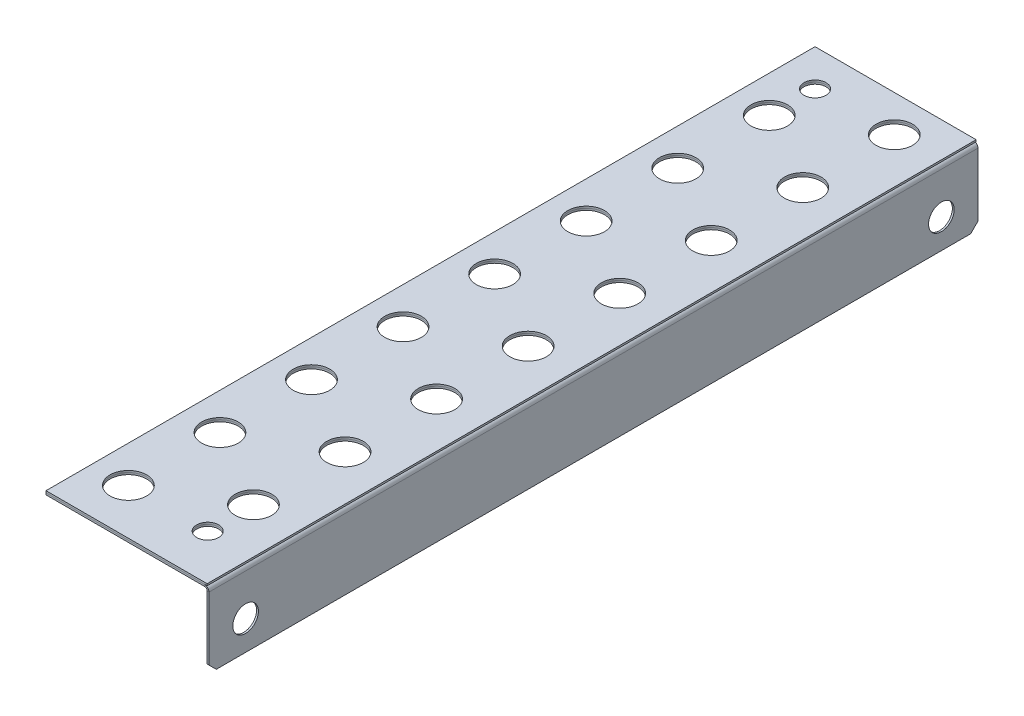
from build123d import *

# Parameters (mm, degrees)
SKETCH1_W                         = 44
SKETCH1_H                         = 210
BOSS_EXTRUDE1_DEPTH               = 0.5
SKETCH1_3_W                       = 44
SKETCH1_3_H                       = 210
BASE_FLANGE1_DEPTH                = 0.5
SKETCH2_3_R                       = 5
CUT_EXTRUDE4_DEPTH                = 10
EDGE_FLANGE1_STRIP_W              = 3.4732
EDGE_FLANGE1_STRIP_H              = 0.5
EDGE_FLANGE1_STRIP_CUT_DEPTH      = 210
EDGE_FLANGE1_DEPTH                = 210
F_7_0_7_DIAMETER_HOLE1_AT_2_COUNT = 2
F_7_0_7_DIAMETER_HOLE1_AT_2_PITCH = 190
BREAK_CORNER1_START               = -162.988113063
BREAK_CORNER1_OUTLINE_W           = 3
BREAK_CORNER1_OUTLINE_H           = 150.081475452
BREAK_CORNER1_DEPTH               = 1.414213562
BREAK_CORNER1_START_2             = -15.909902577
BREAK_CORNER1_2_OUTLINE_W         = 3
BREAK_CORNER1_2_OUTLINE_H         = 1.918524548
BREAK_CORNER1_2_DEPTH             = 2.828427125
SKETCH13_R                        = 3
CUT_EXTRUDE5_DEPTH                = 10


# Read off the part's stored shape, not the designer's step: Break-Corner1
# Sheet-metal steps are written as plain solids
with BuildPart() as part:
    # Sketch1 → Boss-Extrude1 (new body)
    with BuildSketch(Plane(origin=(0, 0, 0), x_dir=(1, 0, 0), z_dir=(0, 1, 0))):
        with Locations((22, -105)):
            Rectangle(SKETCH1_W, SKETCH1_H)
    extrude(amount=BOSS_EXTRUDE1_DEPTH)


with BuildPart() as body_2:
    # Sketch1<3> → Base-Flange1 (new body)
    with BuildSketch(Plane(origin=(0, 0, 0), x_dir=(1, 0, 0), z_dir=(0, 1, 0))):
        with Locations((22, -105)):
            Rectangle(SKETCH1_3_W, SKETCH1_3_H)
    extrude(amount=-BASE_FLANGE1_DEPTH)


with BuildPart() as cut_extrude4_tool:
    # Sketch2<3> → Cut-Extrude4 (new body)
    with BuildSketch(Plane(origin=(0, 0.5, 0), x_dir=(1, 0, 0), z_dir=(0, 1, 0))):
        with Locations(Location((31.650635095, -10, 0), (0, 0, 270))):
            Circle(SKETCH2_3_R)
        with Locations(Location((10, -22.5, 0), (0, 0, 270))):
            Circle(SKETCH2_3_R)
        with Locations(Location((10, -47.5, 0), (0, 0, 270))):
            Circle(SKETCH2_3_R)
        with Locations(Location((31.650635095, -35, 0), (0, 0, 270))):
            Circle(SKETCH2_3_R)
        with Locations(Location((10, -72.5, 0), (0, 0, 270))):
            Circle(SKETCH2_3_R)
        with Locations(Location((31.650635095, -60, 0), (0, 0, 270))):
            Circle(SKETCH2_3_R)
        with Locations(Location((10, -97.5, 0), (0, 0, 270))):
            Circle(SKETCH2_3_R)
        with Locations(Location((31.650635095, -85, 0), (0, 0, 270))):
            Circle(SKETCH2_3_R)
        with Locations(Location((10, -122.5, 0), (0, 0, 270))):
            Circle(SKETCH2_3_R)
        with Locations(Location((31.650635095, -110, 0), (0, 0, 270))):
            Circle(SKETCH2_3_R)
        with Locations(Location((10, -147.5, 0), (0, 0, 270))):
            Circle(SKETCH2_3_R)
        with Locations(Location((31.650635095, -135, 0), (0, 0, 270))):
            Circle(SKETCH2_3_R)
        with Locations(Location((10, -172.5, 0), (0, 0, 270))):
            Circle(SKETCH2_3_R)
        with Locations(Location((31.650635095, -160, 0), (0, 0, 270))):
            Circle(SKETCH2_3_R)
        with Locations(Location((10, -197.5, 0), (0, 0, 270))):
            Circle(SKETCH2_3_R)
        with Locations(Location((31.650635095, -185, 0), (0, 0, 270))):
            Circle(SKETCH2_3_R)
    extrude(amount=-CUT_EXTRUDE4_DEPTH)


with BuildPart() as part_1:
    add(part.part)

    # Cut-Extrude4: cut by cut_extrude4_tool
    add(cut_extrude4_tool.part, mode=Mode.SUBTRACT)


with BuildPart() as body_2_1:
    add(body_2.part)

    # Cut-Extrude4: cut by cut_extrude4_tool
    add(cut_extrude4_tool.part, mode=Mode.SUBTRACT)

    # Edge-Flange1 strip (across the edge) → Edge-Flange1 strip cut (cut)
    with BuildSketch(Plane(origin=(44, -0.5, 0), x_dir=(-1, 0, 0), z_dir=(0, 0, 1))):
        with Locations((-1, -0.25)):
            Rectangle(EDGE_FLANGE1_STRIP_W, EDGE_FLANGE1_STRIP_H)
    extrude(amount=EDGE_FLANGE1_STRIP_CUT_DEPTH, mode=Mode.SUBTRACT)

    # Edge-Flange1 section (across the edge) → Edge-Flange1 (add)
    with BuildSketch(Plane(origin=(44, -0.5, 0), x_dir=(-1, 0, 0), z_dir=(0, 0, 1))):
        with BuildLine():
            Line((-0.5, 0.7366), (-0.5, 20))
            Line((-0.5, 20), (0, 20))
            Line((0, 20), (0, 0.7366))
            ThreePointArc((0, 0.7366), (0.215745145, 0.215745145), (0.7366, 0))
            Line((0.7366, 0), (0.7366, -0.5))
            ThreePointArc((0.7366, -0.5), (-0.137808246, -0.137808246), (-0.5, 0.7366))
        make_face()
    extrude(amount=EDGE_FLANGE1_DEPTH)

    # Sketch12 → Ø7.0 (7) Diameter Hole1 (revolve, cut)
    with BuildSketch(Plane(origin=(44.5, -12.5, 10), x_dir=(0, 0, -1), z_dir=(0, 1, 0))):
        Polygon((0, 0), (0, 17.103012167), (3.5, 15), (3.5, 0), align=None)
    f_7_0_7_diameter_hole1 = revolve(axis=Axis((50.85, -12.5, 10), (-1, 0, 0)), mode=Mode.SUBTRACT)

    # Ø7.0 (7) Diameter Hole1 at 2: Ø7.0 (7) Diameter Hole1 ×2
    with Locations(*[(0, 0, i * F_7_0_7_DIAMETER_HOLE1_AT_2_PITCH) for i in range(1, F_7_0_7_DIAMETER_HOLE1_AT_2_COUNT)]):
        add(f_7_0_7_diameter_hole1, mode=Mode.SUBTRACT)

    # Break-Corner1 outline → Break-Corner1 (cut)
    with BuildSketch(Plane(origin=(0, 0, 0), x_dir=(1, 0, 0), z_dir=(0, 0.707106781186545, -0.70710678118655)).offset(BREAK_CORNER1_START)):
        with Locations((44.5, -61.959262274)):
            Rectangle(BREAK_CORNER1_OUTLINE_W, BREAK_CORNER1_OUTLINE_H)
    extrude(amount=BREAK_CORNER1_DEPTH, mode=Mode.SUBTRACT)

    # Break-Corner1 2 outline → Break-Corner1 2 (cut)
    with BuildSketch(Plane(origin=(0, 0, 0), x_dir=(1, 0, 0), z_dir=(0, 0.707106781186545, -0.70710678118655)).offset(BREAK_CORNER1_START_2)):
        with Locations((44.5, 14.040737726)):
            Rectangle(BREAK_CORNER1_2_OUTLINE_W, BREAK_CORNER1_2_OUTLINE_H)
    extrude(amount=BREAK_CORNER1_2_DEPTH, mode=Mode.SUBTRACT)


with BuildPart() as cut_extrude5_tool:
    # Sketch13 → Cut-Extrude5 (new body)
    with BuildSketch(Plane(origin=(0, 0.5, 0), x_dir=(1, 0, 0), z_dir=(0, 1, 0))):
        with Locations(Location((10, -10, 0), (0, 0, 270))):
            Circle(SKETCH13_R)
        with Locations(Location((31.650635095, -197.5, 0), (0, 0, 270))):
            Circle(SKETCH13_R)
    extrude(amount=-CUT_EXTRUDE5_DEPTH)


with BuildPart() as part_2:
    add(part_1.part)

    # Cut-Extrude5: cut by cut_extrude5_tool
    add(cut_extrude5_tool.part, mode=Mode.SUBTRACT)


with BuildPart() as body_2_2:
    add(body_2_1.part)

    # Cut-Extrude5: cut by cut_extrude5_tool
    add(cut_extrude5_tool.part, mode=Mode.SUBTRACT)


solid = Compound([part_2.part, body_2_2.part])
